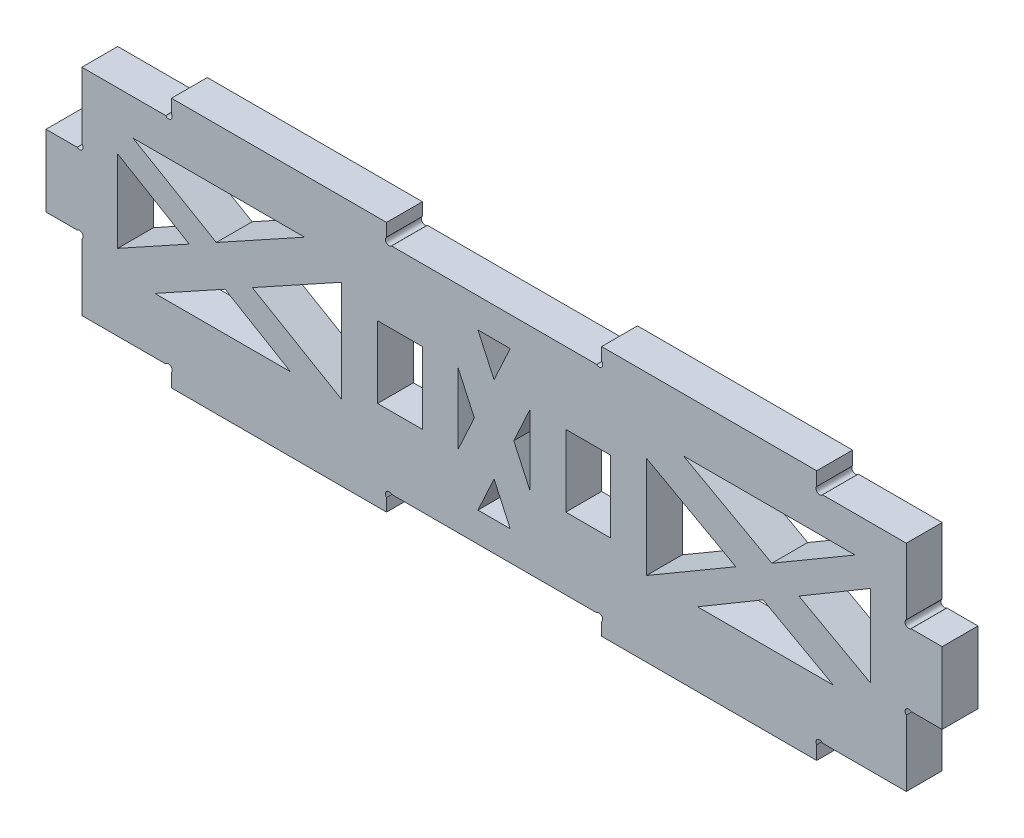
from build123d import *

# Parameters (mm, degrees)
SKETCH1_W           = 317.5
SKETCH1_H           = 76.2
BOSS_EXTRUDE1_DEPTH = 12.7
SKETCH2_W           = 76.2
SKETCH2_H           = 6.35
BOSS_EXTRUDE2_DEPTH = 12.7
SKETCH3_W           = 12.7
SKETCH3_H           = 25.4
SKETCH3_W_2         = 15.875
CUT_EXTRUDE1_DEPTH  = 166.344050392
CUT_EXTRUDE2_DEPTH  = 166.344050392
SKETCH7_R           = 1.27
CUT_EXTRUDE4_DEPTH  = 166.344050392


with BuildPart() as part:
    # Sketch1 → Boss-Extrude1 (new body)
    with BuildSketch(Plane.XY):
        Rectangle(SKETCH1_W, SKETCH1_H)
    extrude(amount=BOSS_EXTRUDE1_DEPTH)

    # Sketch2 → Boss-Extrude2 (add)
    with BuildSketch(Plane.XY.offset(12.7)):
        with Locations((-76.2, -41.275)):
            Rectangle(SKETCH2_W, SKETCH2_H)
        with Locations((76.2, -41.275)):
            Rectangle(SKETCH2_W, SKETCH2_H)
        with Locations((76.2, 41.275)):
            Rectangle(SKETCH2_W, SKETCH2_H)
        with Locations((-76.2, 41.275)):
            Rectangle(SKETCH2_W, SKETCH2_H)
    extrude(amount=-BOSS_EXTRUDE2_DEPTH)

    # Sketch3 → Cut-Extrude1 (cut, through all)
    with BuildSketch(Plane.XY.offset(12.7)):
        with Locations((-152.4, -25.4)):
            Rectangle(SKETCH3_W, SKETCH3_H)
        with Locations((-152.4, 25.4)):
            Rectangle(SKETCH3_W, SKETCH3_H)
        with Locations((152.4, 25.4)):
            Rectangle(SKETCH3_W, SKETCH3_H)
        with Locations((152.4, -25.4)):
            Rectangle(SKETCH3_W, SKETCH3_H)
        with Locations((33.3375, 0)):
            Rectangle(SKETCH3_W_2, SKETCH3_H)
        with Locations((-33.3375, 0)):
            Rectangle(SKETCH3_W_2, SKETCH3_H)
    extrude(amount=-CUT_EXTRUDE1_DEPTH, mode=Mode.SUBTRACT)

    # Sketch4 → Cut-Extrude2 (cut, through all)
    with BuildSketch(Plane.XY.offset(12.7)):
        Polygon((-95.309125936, -4.657389777), (-120.205106965, -18.393103448), (-72.104902526, -18.393103448), align=None)
        Polygon((-133.35, 17.860862384), (-133.35, -11.140748671), (-107.991693016, 2.85004139), align=None)
        Polygon((-85.651314146, 0.671058107), (-53.975, -17.860862384), (-53.975, 18.147645222), align=None)
        Polygon((-67.119893035, 25.4), (-127.920097474, 25.4), (-98.410958103, 8.1359641), align=None)
        Polygon((53.975, -17.860862384), (85.651314146, 0.671058107), (53.975, 18.147645222), align=None)
        Polygon((95.309125936, -4.657389777), (72.104902526, -18.393103448), (120.205106965, -18.393103448), align=None)
        Polygon((127.920097474, 25.4), (67.119893035, 25.4), (98.410958103, 8.1359641), align=None)
        Polygon((107.991693016, 2.85004139), (133.35, -11.140748671), (133.35, 17.860862384), align=None)
        Polygon((-6.988546096, 0), (-12.7, 12.427106699), (-12.7, -12.427106699), align=None)
        Polygon((5.711453904, -27.632938607), (0, -15.205831908), (-5.711453904, -27.632938607), align=None)
        Polygon((-5.711453904, 27.632938607), (0, 15.205831908), (5.711453904, 27.632938607), align=None)
        Polygon((12.7, 12.427106699), (6.988546096, 0), (12.7, -12.427106699), align=None)
    extrude(amount=-CUT_EXTRUDE2_DEPTH, mode=Mode.SUBTRACT)

    # Sketch7 → Cut-Extrude4 (cut, through all)
    with BuildSketch(Plane.XY.offset(12.7)):
        with Locations((-115.322216931, -38.853639533)):
            Circle(SKETCH7_R)
        with Locations((-37.219883345, -39.015584335)):
            Circle(SKETCH7_R)
        with Locations((37.219883345, -39.015584335)):
            Circle(SKETCH7_R)
        with Locations((115.322216931, -38.853639533)):
            Circle(SKETCH7_R)
        with Locations((115.322216931, 38.853639533)):
            Circle(SKETCH7_R)
        with Locations((37.219883345, 39.015584335)):
            Circle(SKETCH7_R)
        with Locations((-37.219883345, 39.015584335)):
            Circle(SKETCH7_R)
        with Locations((-115.322216931, 38.853639533)):
            Circle(SKETCH7_R)
        with Locations((-146.889550892, -13.652918832)):
            Circle(SKETCH7_R)
        with Locations((-146.889550892, 13.652918832)):
            Circle(SKETCH7_R)
        with Locations((146.889550892, -13.652918832)):
            Circle(SKETCH7_R)
        with Locations((146.889550892, 13.652918832)):
            Circle(SKETCH7_R)
    extrude(amount=-CUT_EXTRUDE4_DEPTH, mode=Mode.SUBTRACT)


solid = part.part
